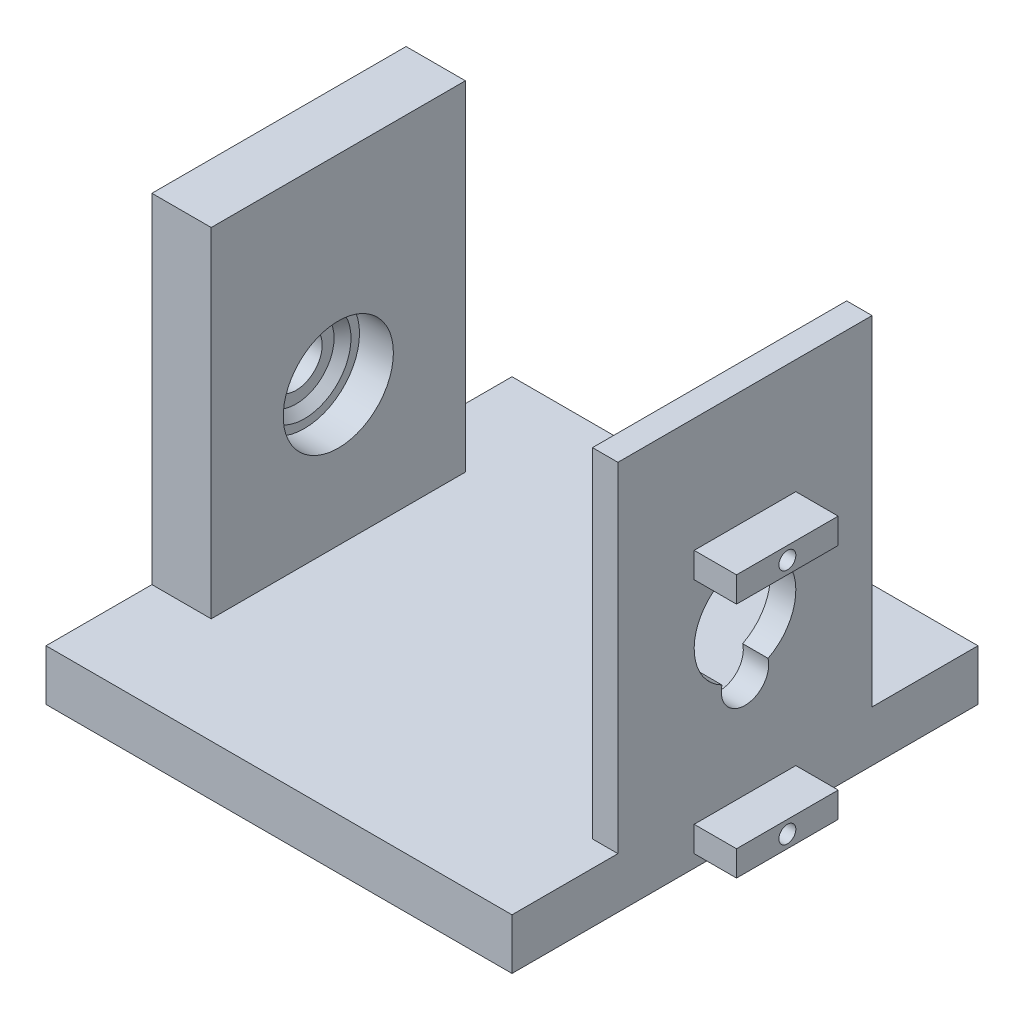
from build123d import *

# Parameters (mm, degrees)
CROQUIS8_W              = 55
CROQUIS8_H              = 55
CROQUIS8_R              = 22
SALIENTE_EXTRUIR4_DEPTH = 6
CROQUIS8_3_R            = 22
CORTAR_EXTRUIR6_DEPTH   = 3
REDONDEO1_R             = 0.5
CROQUIS9_W              = 7
CROQUIS9_H              = 30
CROQUIS9_W_2            = 3
SALIENTE_EXTRUIR5_DEPTH = 40
SALIENTE_EXTRUIR6_DEPTH = 5
CORTAR_EXTRUIR7_DEPTH   = 5
CORTAR_EXTRUIR8_REACH   = 77.374
CROQUIS11_R             = 3.1
CROQUIS11_3_R           = 6.5
CORTAR_EXTRUIR9_DEPTH   = 4
CROQUIS12_R             = 5.5
CROQUIS12_R_2           = 3.1
CORTAR_EXTRUIR10_DEPTH  = 1
CHAFL_N1_SIZE           = 1


with BuildPart() as part:
    # Croquis8 → Saliente-Extruir4 (new body)
    # profile 1 of 2: a face of its own
    with BuildSketch(Plane(origin=(0, 0, 0), x_dir=(1, 0, 0), z_dir=(0, 1, 0))):
        Rectangle(CROQUIS8_W, CROQUIS8_H)
        Circle(CROQUIS8_R, mode=Mode.SUBTRACT)
    # profile 2 of 2: a face of its own
    with BuildSketch(Plane(origin=(0, 0, 0), x_dir=(1, 0, 0), z_dir=(0, 1, 0))):
        Circle(CROQUIS8_R)
    extrude(amount=SALIENTE_EXTRUIR4_DEPTH)

    # Croquis8<3> → Cortar-Extruir6 (cut)
    with BuildSketch(Plane(origin=(0, 0, 0), x_dir=(1, 0, 0), z_dir=(0, 1, 0))):
        with Locations(Location((0, 0, 0), (0, 0, 270))):
            Circle(CROQUIS8_3_R)
    extrude(amount=CORTAR_EXTRUIR6_DEPTH, mode=Mode.SUBTRACT)

    # Redondeo1
    redondeo1_edges = [part.edges().sort_by_distance(p)[0] for p in [
        (0, 3, -22),
    ]]
    fillet(redondeo1_edges, radius=REDONDEO1_R)

    # Croquis9 → Saliente-Extruir5 (add)
    with BuildSketch(Plane(origin=(0, 6, 0), x_dir=(1, 0, 0), z_dir=(0, 1, 0))):
        with Locations((-24, 0)):
            Rectangle(CROQUIS9_W, CROQUIS9_H)
        with Locations((26, 0)):
            Rectangle(CROQUIS9_W_2, CROQUIS9_H)
    extrude(amount=SALIENTE_EXTRUIR5_DEPTH)

    # Croquis10 → Saliente-Extruir6 (add)
    with BuildSketch(Plane(origin=(27.5, 0, 0), x_dir=(0, 0, -1), z_dir=(1, 0, 0))):
        with BuildLine():
            Line((0, 2), (0, 1.5))
            Line((0, 1.5), (6, 1.5))
            Line((6, 1.5), (6, 4.5))
            Line((6, 4.5), (0, 4.5))
            Line((0, 4.5), (0, 4))
            ThreePointArc((0, 4), (0.707106781, 3.707106781), (1, 3))
            ThreePointArc((1, 3), (0.707106781, 2.292893219), (0, 2))
        make_face()
        with BuildLine():
            Line((-6, 1.5), (0, 1.5))
            Line((0, 1.5), (0, 2))
            ThreePointArc((0, 2), (-1, 3), (0, 4))
            Line((0, 4), (0, 4.5))
            Line((0, 4.5), (-6, 4.5))
            Line((-6, 4.5), (-6, 1.5))
        make_face()
        with BuildLine():
            Line((-6, 29.5), (0, 29.5))
            Line((0, 29.5), (0, 30))
            ThreePointArc((0, 30), (-1, 31), (0, 32))
            Line((0, 32), (0, 32.5))
            Line((0, 32.5), (-6, 32.5))
            Line((-6, 32.5), (-6, 29.5))
        make_face()
        with BuildLine():
            Line((0, 30), (0, 29.5))
            Line((0, 29.5), (6, 29.5))
            Line((6, 29.5), (6, 32.5))
            Line((6, 32.5), (0, 32.5))
            Line((0, 32.5), (0, 32))
            ThreePointArc((0, 32), (0.707106781, 31.707106781), (1, 31))
            ThreePointArc((1, 31), (0.707106781, 30.292893219), (0, 30))
        make_face()
    extrude(amount=SALIENTE_EXTRUIR6_DEPTH)

    # Croquis10<3> → Cortar-Extruir7 (cut)
    with BuildSketch(Plane(origin=(27.5, 0, 0), x_dir=(0, 0, -1), z_dir=(1, 0, 0))):
        with BuildLine():
            ThreePointArc((-2.722711067, 17.103333333), (-2.198787545, 14.716410275), (0, 13.65))
            Line((0, 13.65), (0, 16.45))
            ThreePointArc((0, 16.45), (-1.4, 16.615619142), (-2.722711067, 17.103333333))
        make_face()
        with BuildLine():
            Line((0, 16.45), (0, 13.65))
            ThreePointArc((0, 13.65), (1.979898987, 14.470101013), (2.8, 16.45))
            ThreePointArc((2.8, 16.45), (2.780610633, 16.778944533), (2.722711067, 17.103333333))
            ThreePointArc((2.722711067, 17.103333333), (1.4, 16.615619142), (0, 16.45))
        make_face()
        with BuildLine():
            ThreePointArc((-2.722711067, 17.103333333), (-1.4, 16.615619142), (0, 16.45))
            Line((0, 16.45), (0, 19.25))
            ThreePointArc((0, 19.25), (-1.733589725, 18.648787545), (-2.722711067, 17.103333333))
        make_face()
        with BuildLine():
            Line((0, 19.25), (0, 16.45))
            ThreePointArc((0, 16.45), (1.4, 16.615619142), (2.722711067, 17.103333333))
            ThreePointArc((2.722711067, 17.103333333), (1.733589725, 18.648787545), (0, 19.25))
        make_face()
        with BuildLine():
            ThreePointArc((0, 28.45), (-5.834380858, 23.85), (-2.722711067, 17.103333333))
            ThreePointArc((-2.722711067, 17.103333333), (-1.733589725, 18.648787545), (0, 19.25))
            Line((0, 19.25), (0, 28.45))
        make_face()
        with BuildLine():
            Line((0, 28.45), (0, 19.25))
            ThreePointArc((0, 19.25), (1.733589725, 18.648787545), (2.722711067, 17.103333333))
            ThreePointArc((2.722711067, 17.103333333), (5.115479763, 19.314419225), (6, 22.45))
            ThreePointArc((6, 22.45), (4.242640687, 26.692640687), (0, 28.45))
        make_face()
    extrude(amount=-CORTAR_EXTRUIR7_DEPTH, mode=Mode.SUBTRACT)

    # Croquis11 → Cortar-Extruir8 (cut, up to next)
    with BuildSketch(Plane(origin=(-20.5, 0, 0), x_dir=(0, 0, -1), z_dir=(1, 0, 0)), mode=Mode.PRIVATE) as cortar_extruir8_sk1:
        with Locations((0, 22.45)):
            Circle(CROQUIS11_R)
    cortar_extruir8_tool1 = extrude(cortar_extruir8_sk1.sketch, amount=-CORTAR_EXTRUIR8_REACH, mode=Mode.PRIVATE) & part.part
    add(cortar_extruir8_tool1.solids().sort_by_distance((-20.5, 22.45, 0))[0], mode=Mode.SUBTRACT)

    # Croquis11<3> → Cortar-Extruir9 (cut)
    with BuildSketch(Plane(origin=(-20.5, 0, 0), x_dir=(0, 0, -1), z_dir=(1, 0, 0))):
        with Locations((0, 22.45)):
            Circle(CROQUIS11_3_R)
    extrude(amount=-CORTAR_EXTRUIR9_DEPTH, mode=Mode.SUBTRACT)

    # Croquis12 → Cortar-Extruir10 (cut)
    with BuildSketch(Plane(origin=(-24.5, 0, 0), x_dir=(0, 0, -1), z_dir=(1, 0, 0))):
        with Locations((0, 22.45)):
            Circle(CROQUIS12_R)
        with Locations((0, 22.45)):
            Circle(CROQUIS12_R_2, mode=Mode.SUBTRACT)
    extrude(amount=-CORTAR_EXTRUIR10_DEPTH, mode=Mode.SUBTRACT)

    # Chaflán1
    chafl_n1_edges = [part.edges().sort_by_distance(p)[0] for p in [
        (-25.5, 22.45, 5.5),
    ]]
    chamfer(chafl_n1_edges, length=CHAFL_N1_SIZE - 0.0001)  # a hair under: the kernel refuses the full size


solid = part.part
